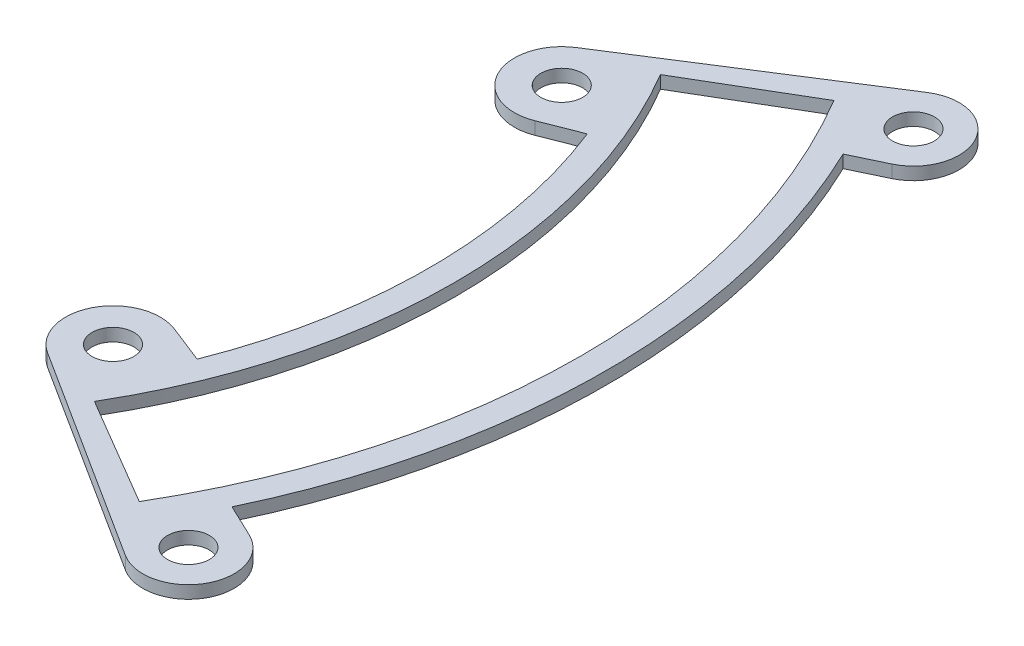
from build123d import *

# Parameters (mm, degrees)
SKETCH1_R           = 1.65
BOSS_EXTRUDE1_DEPTH = 1


with BuildPart() as part:
    # Sketch1 → Boss-Extrude1 (new body)
    with BuildSketch(Plane(origin=(0, 0, 0), x_dir=(1, 0, 0), z_dir=(0, 1, 0))):
        with BuildLine():
            Line((50.544775924, 24.108621421), (53.15320507, 25.352778303))
            ThreePointArc((53.15320507, 25.352778303), (54.752823812, 30.349985831), (49.667282695, 31.64154874))
            Line((49.667282695, 31.64154874), (32.740836917, 20.858213514))
            ThreePointArc((32.740836917, 20.858213514), (31.418686002, 16.008620108), (36.119230292, 14.227743183))
            Line((36.119230292, 14.227743183), (39.077537855, 15.393051522))
            ThreePointArc((39.077537855, 15.393051522), (42, 0), (39.077537855, -15.393051522))
            Line((39.077537855, -15.393051522), (36.119230292, -14.227743183))
            ThreePointArc((36.119230292, -14.227743183), (31.418686002, -16.008620108), (32.740836917, -20.858213514))
            Line((32.740836917, -20.858213514), (49.667282695, -31.64154874))
            ThreePointArc((49.667282695, -31.64154874), (54.752823812, -30.349985831), (53.15320507, -25.352778303))
            Line((53.15320507, -25.352778303), (50.544775924, -24.108621421))
            ThreePointArc((50.544775924, -24.108621421), (56, 0), (50.544775924, 24.108621421))
        make_face()
        with Locations((34.749254443, -17.70562949)):
            Circle(SKETCH1_R, mode=Mode.SUBTRACT)
        with Locations((51.602562721, -28.603767595)):
            Circle(SKETCH1_R, mode=Mode.SUBTRACT)
        with BuildLine():
            Line((46.527974664, -27.4070716), (37.911683059, -22.33168797))
            ThreePointArc((37.911683059, -22.33168797), (44, 0), (37.911683059, 22.33168797))
            Line((37.911683059, 22.33168797), (46.527974664, 27.4070716))
            ThreePointArc((46.527974664, 27.4070716), (54, 0), (46.527974664, -27.4070716))
        make_face(mode=Mode.SUBTRACT)
        with Locations((34.749254443, 17.70562949)):
            Circle(SKETCH1_R, mode=Mode.SUBTRACT)
        with Locations((51.602562721, 28.603767595)):
            Circle(SKETCH1_R, mode=Mode.SUBTRACT)
    extrude(amount=BOSS_EXTRUDE1_DEPTH)


solid = part.part
